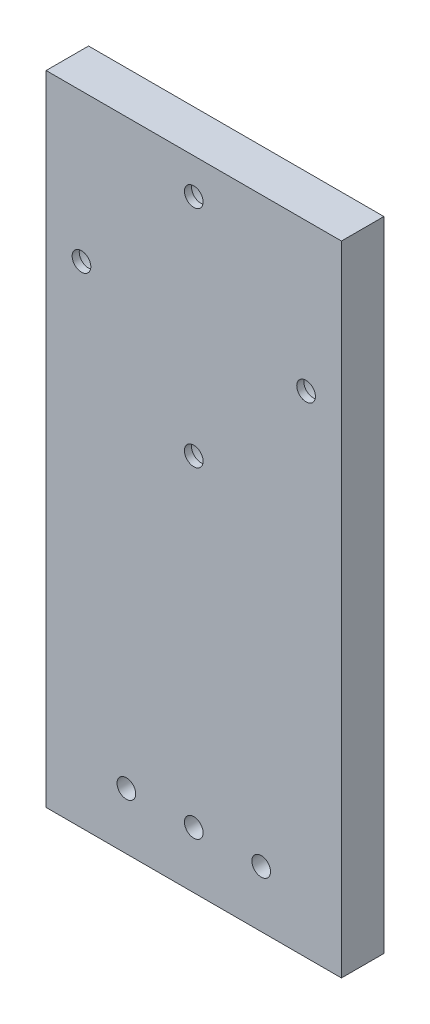
from build123d import *

# Parameters (mm, degrees)
SKETCH1_W           = 41.75
SKETCH1_H           = 90.225
SKETCH1_R           = 1.32
BOSS_EXTRUDE1_DEPTH = 6
SKETCH2_R           = 3.25
CUT_EXTRUDE1_DEPTH  = 5


with BuildPart() as part:
    # Sketch1 → Boss-Extrude1 (new body)
    with BuildSketch(Plane.XY):
        with Locations((0, -24.2375)):
            Rectangle(SKETCH1_W, SKETCH1_H)
        with Locations((0, -15.875)):
            Circle(SKETCH1_R, mode=Mode.SUBTRACT)
        with Locations((-15.875, 0)):
            Circle(SKETCH1_R, mode=Mode.SUBTRACT)
        with Locations((0, 15.875)):
            Circle(SKETCH1_R, mode=Mode.SUBTRACT)
        with Locations((-9.53, -61.35)):
            Circle(SKETCH1_R, mode=Mode.SUBTRACT)
        with Locations((0, -61.35)):
            Circle(SKETCH1_R, mode=Mode.SUBTRACT)
        with Locations((9.53, -61.35)):
            Circle(SKETCH1_R, mode=Mode.SUBTRACT)
        with Locations((15.875, 0)):
            Circle(SKETCH1_R, mode=Mode.SUBTRACT)
    extrude(amount=BOSS_EXTRUDE1_DEPTH)

    # Sketch2 → Cut-Extrude1 (cut)
    with BuildSketch(Plane(origin=(0, 0, 0), x_dir=(-1, 0, 0), z_dir=(0, 0, -1))):
        with Locations((-15.875, 0)):
            Circle(SKETCH2_R)
        with Locations((0, 15.88)):
            Circle(SKETCH2_R)
        with Locations((15.88, 0.005)):
            Circle(SKETCH2_R)
        with Locations((0.005, -15.875)):
            Circle(SKETCH2_R)
    extrude(amount=-CUT_EXTRUDE1_DEPTH, mode=Mode.SUBTRACT)


solid = part.part
